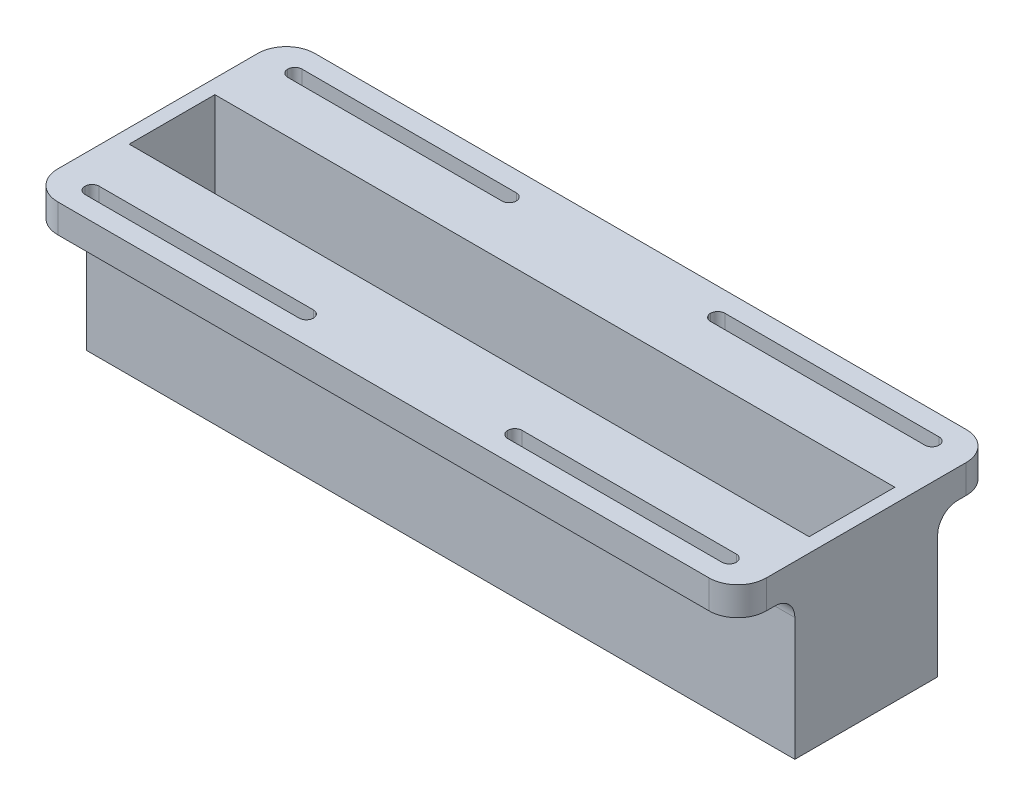
from build123d import *

# Parameters (mm, degrees)
ESQUISSE1_W             = 124
ESQUISSE1_H             = 66
ESQUISSE1_W_2           = 119
ESQUISSE1_H_2           = 61
BOSS_EXTRU_1_DEPTH      = 15
ESQUISSE2_W             = 124
ESQUISSE2_H             = 30
BOSS_EXTRU_2_DEPTH      = 5
ESQUISSE3_W             = 124
ESQUISSE3_H             = 30
BOSS_EXTRU_3_DEPTH      = 5
ESQUISSE2_4_W           = 119
ESQUISSE2_4_H           = 33.5
ENL_V_MAT_EXTRU_2_DEPTH = 139.544216769
ESQUISSE4_W             = 124
ESQUISSE4_H             = 5
BOSS_EXTRU_4_DEPTH      = 10
ESQUISSE6_W             = 124
ESQUISSE6_H             = 5
BOSS_EXTRU_5_DEPTH      = 10
ESQUISSE5_W             = 40
ESQUISSE5_H             = 2.5
ENL_V_MAT_EXTRU_3_DEPTH = 10
CONG_5_R                = 5
CONG_6_R                = 3.5
CONG_7_R                = 1.25
ESQUISSE7_W             = 37
ESQUISSE7_H             = 15
ENL_V_MAT_EXTRU_4_DEPTH = 129.134694755


with BuildPart() as part:
    # Esquisse1 → Boss.-Extru.1 (new body)
    with BuildSketch(Plane.XY):
        with Locations((59.5, 30.5)):
            Rectangle(ESQUISSE1_W, ESQUISSE1_H)
        with Locations((59.5, 30.5)):
            Rectangle(ESQUISSE1_W_2, ESQUISSE1_H_2, mode=Mode.SUBTRACT)
    extrude(amount=BOSS_EXTRU_1_DEPTH)

    # Esquisse2 → Boss.-Extru.2 (add)
    with BuildSketch(Plane.XY.offset(15)):
        with Locations((59.5, 12.5)):
            Rectangle(ESQUISSE2_W, ESQUISSE2_H)
    extrude(amount=BOSS_EXTRU_2_DEPTH)

    # Esquisse3 → Boss.-Extru.3 (add)
    with BuildSketch(Plane(origin=(0, 0, 0), x_dir=(-1, 0, 0), z_dir=(0, 0, -1))):
        with Locations((-59.5, 12.5)):
            Rectangle(ESQUISSE3_W, ESQUISSE3_H)
    extrude(amount=BOSS_EXTRU_3_DEPTH)

    # Esquisse2<4> → Enlèv. mat.-Extru.2 (cut, through all)
    with BuildSketch(Plane.XY.offset(15)):
        Polygon((-2.5, 63.5), (-2.5, 27.5), (0, 27.5), (0, 61), (119, 61), (119, 27.5), (121.5, 27.5), (121.5, 63.5), align=None)
        with Locations((59.5, 44.25)):
            Rectangle(ESQUISSE2_4_W, ESQUISSE2_4_H)
        Polygon((-7.324686497, 27.5), (-2.5, 27.5), (-2.5, 63.5), (121.5, 63.5), (121.5, 27.5), (134.265191069, 27.5), (134.265191069, 70.183408252), (-7.324686497, 70.183408252), align=None)
    extrude(amount=-ENL_V_MAT_EXTRU_2_DEPTH, mode=Mode.SUBTRACT)

    # Esquisse4 → Boss.-Extru.4 (add)
    with BuildSketch(Plane.XY.offset(20)):
        with Locations((59.5, 25)):
            Rectangle(ESQUISSE4_W, ESQUISSE4_H)
    extrude(amount=BOSS_EXTRU_4_DEPTH)

    # Esquisse6 → Boss.-Extru.5 (add)
    with BuildSketch(Plane(origin=(0, 0, -5), x_dir=(-1, 0, 0), z_dir=(0, 0, -1))):
        with Locations((-59.5, 25)):
            Rectangle(ESQUISSE6_W, ESQUISSE6_H)
    extrude(amount=BOSS_EXTRU_5_DEPTH)

    # Esquisse5 → Enlèv. mat.-Extru.3 (cut)
    with BuildSketch(Plane(origin=(0, 27.5, 0), x_dir=(1, 0, 0), z_dir=(0, 1, 0))):
        with Locations((22.5, -25.25)):
            Rectangle(ESQUISSE5_W, ESQUISSE5_H)
        with Locations((96.5, -25.25)):
            Rectangle(ESQUISSE5_W, ESQUISSE5_H)
        with Locations((22.5, 10.25)):
            Rectangle(ESQUISSE5_W, ESQUISSE5_H)
        with Locations((96.5, 10.25)):
            Rectangle(ESQUISSE5_W, ESQUISSE5_H)
    extrude(amount=-ENL_V_MAT_EXTRU_3_DEPTH, mode=Mode.SUBTRACT)

    # Congé5
    cong_5_edges = [part.edges().sort_by_distance(p)[0] for p in [
        (121.5, 25, 30),
        (121.5, 25, -15),
        (-2.5, 25, -15),
        (-2.5, 25, 30),
    ]]
    fillet(cong_5_edges, radius=CONG_5_R)

    # Congé6
    cong_6_edges = [part.edges().sort_by_distance(p)[0] for p in [
        (59.5, 22.5, 20),
        (59.5, 22.5, -5),
    ]]
    fillet(cong_6_edges, radius=CONG_6_R)

    # Congé7
    cong_7_edges = [part.edges().sort_by_distance(p)[0] for p in [
        (76.5, 25, -11.5),
        (76.5, 25, -9),
        (116.5, 25, -9),
        (116.5, 25, -11.5),
        (42.5, 25, -11.5),
        (42.5, 25, -9),
        (2.5, 25, -11.5),
        (2.5, 25, -9),
        (2.5, 25, 24),
        (2.5, 25, 26.5),
        (42.5, 25, 24),
        (42.5, 25, 26.5),
        (76.5, 25, 24),
        (76.5, 25, 26.5),
        (116.5, 25, 24),
        (116.5, 25, 26.5),
    ]]
    fillet(cong_7_edges, radius=CONG_7_R - 0.0001)  # a hair under: the kernel refuses the full size

    # Esquisse7 → Enlèv. mat.-Extru.4 (cut, through all)
    with BuildSketch(Plane(origin=(0, 0, 0), x_dir=(1, 0, 0), z_dir=(0, 1, 0))):
        with Locations((97.5, -7.5)):
            Rectangle(ESQUISSE7_W, ESQUISSE7_H)
    extrude(amount=-ENL_V_MAT_EXTRU_4_DEPTH, mode=Mode.SUBTRACT)


solid = part.part
